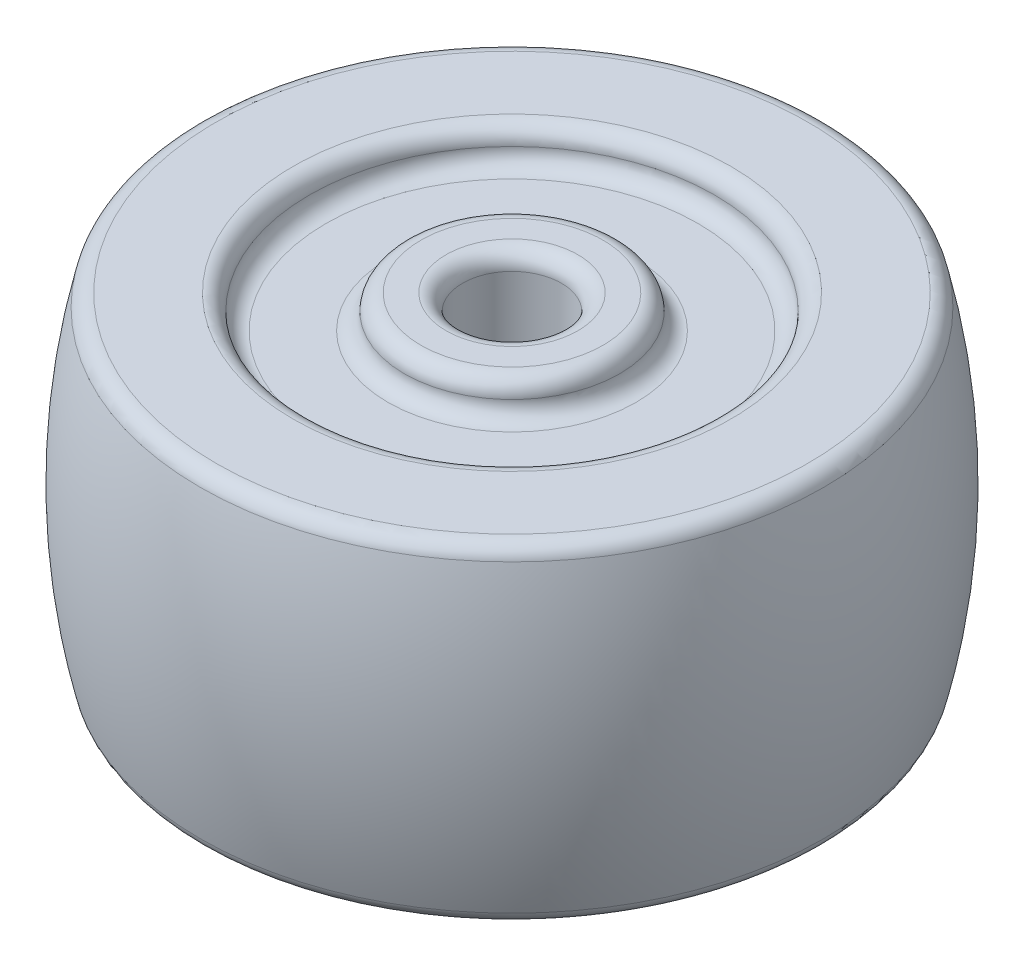
from build123d import *

# Parameters (mm, degrees)
FILLET_1_R = 1


with BuildPart() as part:
    # 草图1 → 旋转1 (revolve)
    with BuildSketch(Plane.XY, mode=Mode.PRIVATE) as revolve_1_sk:
        with BuildLine():
            Line((-12.283202798, 10), (-18.729833462, 10))
            ThreePointArc((-18.729833462, 10), (-20, 0), (-18.729833462, -10))
            Line((-18.729833462, -10), (-12.283202798, -10))
            Line((-12.283202798, -10), (-12.283202798, -8))
            Line((-12.283202798, -8), (-6.528547037, -8))
            Line((-6.528547037, -8), (-6.528547037, -10))
            Line((-6.528547037, -10), (-3, -10))
            Line((-3, -10), (-3, 10))
            Line((-3, 10), (-6.528547037, 10))
            Line((-6.528547037, 10), (-6.528547037, 8))
            Line((-6.528547037, 8), (-12.283202798, 8))
            Line((-12.283202798, 8), (-12.283202798, 10))
        make_face()
    revolve(revolve_1_sk.sketch.rotate(Axis((0, 10, 0), (0, -1, 0)), 270), axis=Axis((0, 10, 0), (0, -1, 0)))

    # 圆角1
    fillet_1_edges = [part.edges().sort_by_distance(p)[0] for p in [
        (0, 8, -12.283202798),
        (0, 8, -6.528547037),
        (0, 10, -6.528547037),
        (0, 10, -3),
        (0, -10, -3),
        (0, -10, -6.528547037),
        (0, -8, -12.283202798),
        (0, -10, -12.283202798),
        (0, -10, -18.729833462),
        (0, 10, -18.729833462),
        (0, 10, -12.283202798),
    ]]
    fillet(fillet_1_edges, radius=FILLET_1_R - 0.0001)  # a hair under: the kernel refuses the full size


solid = part.part
